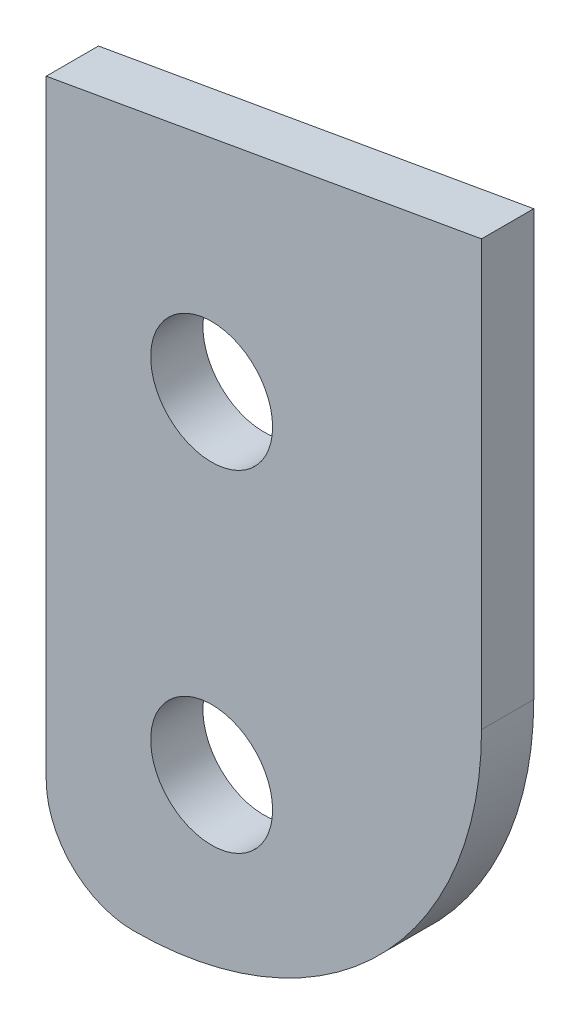
from build123d import *

# Parameters (mm, degrees)
EXTRUDE_1_DEPTH     = 6
SKETCH_2_R          = 7
CUT_EXTRUDE_1_DEPTH = 103.099676082
FILLET_2_R          = 40
FILLET_3_R          = 10


with BuildPart() as part:
    # Эскиз1 → Бобышка-Вытянуть1 (new body)
    with BuildSketch(Plane.XY):
        Polygon((0, 0), (0, 80), (50, 88.816349035), (50, 0), align=None)
    extrude(amount=EXTRUDE_1_DEPTH)

    # Эскиз2 → Вырез-Вытянуть1 (cut, through all)
    with BuildSketch(Plane.XY):
        with Locations((19, 58.1)):
            Circle(SKETCH_2_R)
        with Locations((19, 20)):
            Circle(SKETCH_2_R)
    extrude(amount=CUT_EXTRUDE_1_DEPTH, mode=Mode.SUBTRACT)

    # Скругление2
    fillet_2_edges = [part.edges().sort_by_distance(p)[0] for p in [
        (50, 0, 3),
    ]]
    fillet(fillet_2_edges, radius=FILLET_2_R)

    # Скругление3
    fillet_3_edges = [part.edges().sort_by_distance(p)[0] for p in [
        (0, 0, 3),
    ]]
    fillet(fillet_3_edges, radius=FILLET_3_R - 0.0001)  # a hair under: the kernel refuses the full size


solid = part.part
